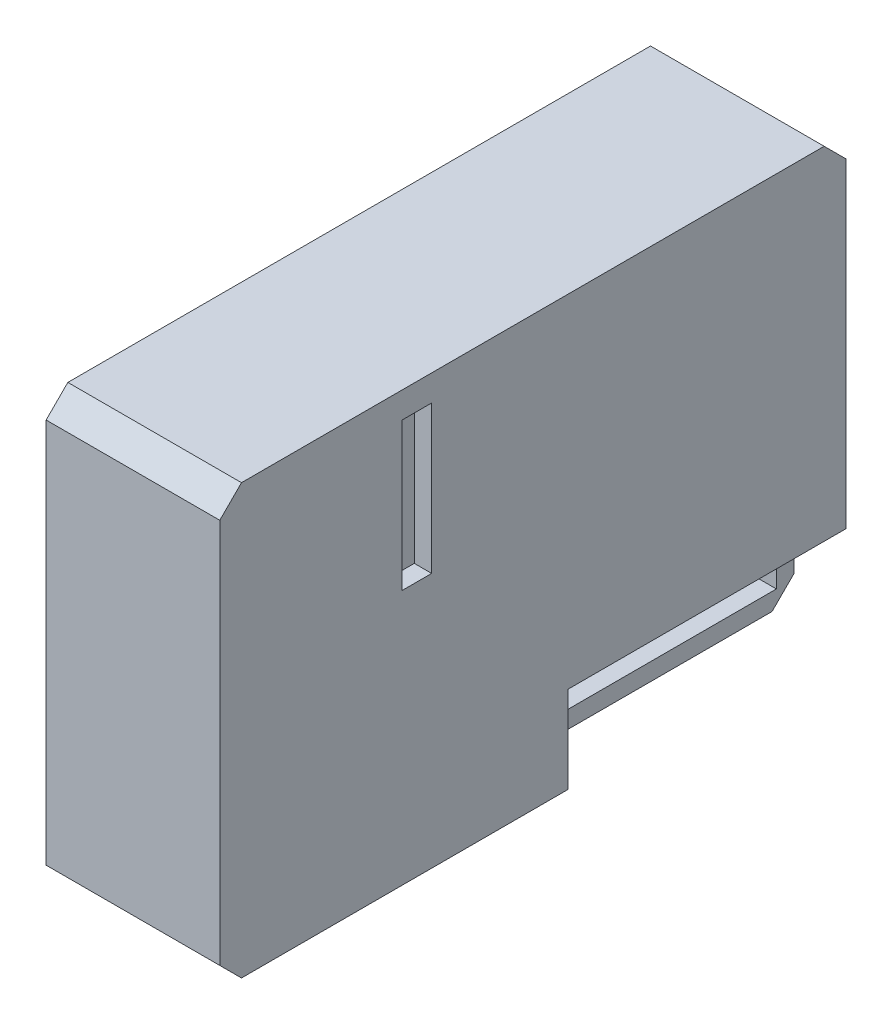
from build123d import *

# Parameters (mm, degrees)
THICKEN2_OUTLINE_W   = 62.738
THICKEN2_OUTLINE_H   = 91.567
THICKEN2_OUTLINE_W_2 = 57.658
THICKEN2_OUTLINE_H_2 = 86.487
THICKEN2_DEPTH       = 25.4
THICKEN2_2_OUTLINE_W = 57.658
THICKEN2_2_OUTLINE_H = 86.487
THICKEN2_2_DEPTH     = 2.54
THICKEN2_START       = 22.86
THICKEN2_3_OUTLINE_W = 57.658
THICKEN2_3_OUTLINE_H = 86.487
THICKEN2_3_DEPTH     = 2.54
CHAMFER2_SIZE        = 3.175
SKETCH10_W           = 56.529750703
SKETCH10_H           = 12.7
CUT_EXTRUDE2_DEPTH   = 7.62
CUT_EXTRUDE3_REACH   = 104.516
SKETCH11_W           = 4.318
SKETCH11_H           = 21.59


# Read off the part's stored shape, not the designer's step: Thicken2
with BuildPart() as part:
    # Thicken2 outline → Thicken2 (new body)
    with BuildSketch(Plane.YZ):
        with Locations((7.10118863, 45.7835)):
            Rectangle(THICKEN2_OUTLINE_W, THICKEN2_OUTLINE_H)
        with Locations((7.10118863, 45.7835)):
            Rectangle(THICKEN2_OUTLINE_W_2, THICKEN2_OUTLINE_H_2, mode=Mode.SUBTRACT)
    extrude(amount=THICKEN2_DEPTH)

    # Thicken2 2 outline → Thicken2 2 (add)
    with BuildSketch(Plane.YZ):
        with Locations((7.10118863, 45.7835)):
            Rectangle(THICKEN2_2_OUTLINE_W, THICKEN2_2_OUTLINE_H)
    extrude(amount=THICKEN2_2_DEPTH)

    # Thicken2 3 outline → Thicken2 3 (add)
    with BuildSketch(Plane.YZ.offset(THICKEN2_START)):
        with Locations((7.10118863, 45.7835)):
            Rectangle(THICKEN2_3_OUTLINE_W, THICKEN2_3_OUTLINE_H)
    extrude(amount=THICKEN2_3_DEPTH)

    # Chamfer2
    chamfer2_edges = [part.edges().sort_by_distance(p)[0] for p in [
        (12.7, 38.47018863, 0),
        (12.7, 38.47018863, 91.567),
        (12.7, -24.26781137, 0),
        (12.7, -24.26781137, 91.567),
    ]]
    chamfer(chamfer2_edges, length=CHAMFER2_SIZE)

    # Sketch10 → Cut-Extrude2 (cut)
    with BuildSketch(Plane(origin=(25.4, 0, 0), x_dir=(0, 0, -1), z_dir=(1, 0, 0))):
        with Locations((-12.375124648, -17.91781137)):
            Rectangle(SKETCH10_W, SKETCH10_H)
    extrude(amount=-CUT_EXTRUDE2_DEPTH, mode=Mode.SUBTRACT)

    # Sketch11 → Cut-Extrude3 (cut, up to next)
    with BuildSketch(Plane(origin=(25.4, 0, 0), x_dir=(0, 0, -1), z_dir=(1, 0, 0)), mode=Mode.PRIVATE) as cut_extrude3_sk1:
        with Locations((-62.738, 23.86518863)):
            Rectangle(SKETCH11_W, SKETCH11_H)
    cut_extrude3_tool1 = extrude(cut_extrude3_sk1.sketch, amount=-CUT_EXTRUDE3_REACH, mode=Mode.PRIVATE) & part.part
    add(cut_extrude3_tool1.solids().sort_by_distance((25.4, 23.865189, 62.738))[0], mode=Mode.SUBTRACT)


solid = part.part
